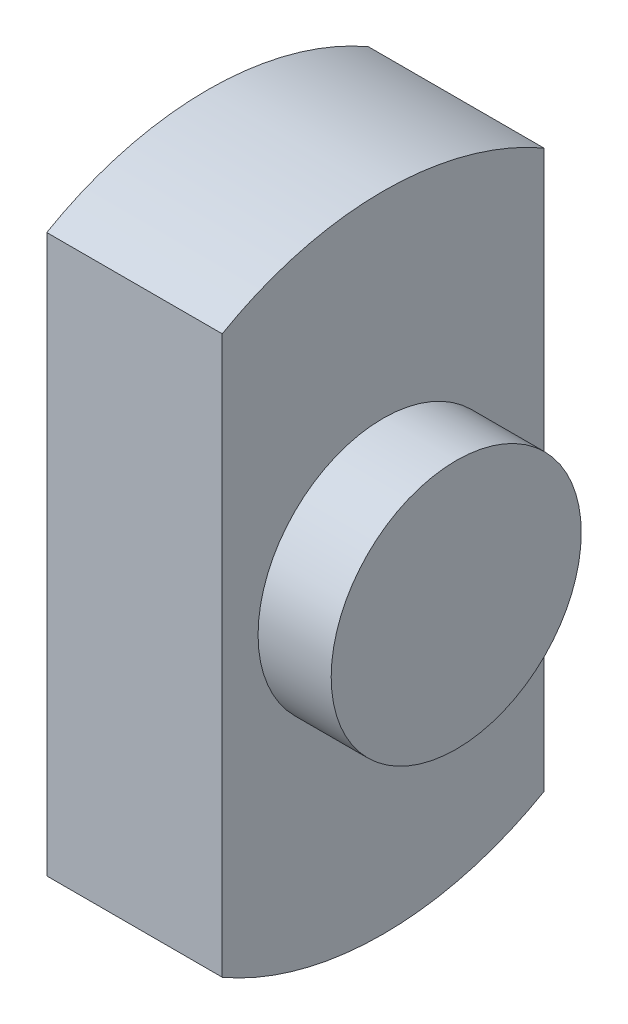
from build123d import *

# Parameters (mm, degrees)
SKETCH1_R           = 22
BOSS_EXTRUDE1_DEPTH = 12
CUT_EXTRUDE2_DEPTH  = 5.5
SKETCH15_W          = 18
SKETCH15_H          = 24.118038922
CUT_EXTRUDE3_DEPTH  = 3
SKETCH16_R          = 8.55
BOSS_EXTRUDE2_DEPTH = 5
SKETCH17_W          = 4
SKETCH17_H          = 1.75
BOSS_EXTRUDE3_DEPTH = 1
SKETCH18_W          = 4.25
SKETCH18_H          = 1.737607108
BOSS_EXTRUDE4_DEPTH = 1
CUT_EXTRUDE4_DEPTH  = 12


# Read off the part's stored shape, not the designer's step: Cut-Extrude4
with BuildPart() as part:
    # Sketch1 → Boss-Extrude1 (new body)
    with BuildSketch(Plane(origin=(0, 0, 0), x_dir=(0, 0, -1), z_dir=(1, 0, 0))):
        Circle(SKETCH1_R)
    extrude(amount=BOSS_EXTRUDE1_DEPTH)

    # Sketch13 → Cut-Extrude2 (cut)
    with BuildSketch(Plane(origin=(0, 0, 0), x_dir=(0, 0, -1), z_dir=(1, 0, 0))):
        with BuildLine():
            Line((-2.670420152, -16.85816067), (-2.670420152, -16.530371213))
            Line((-2.670420152, -16.530371213), (-4.762392892, -10))
            Line((-4.762392892, -10), (-4.762392892, -6.943148259))
            Line((-4.762392892, -6.943148259), (-6.5, -6.943148259))
            Line((-6.5, -6.943148259), (-6.5, 19.556851741))
            Line((-6.5, 19.556851741), (6.5, 19.556851741))
            Line((6.5, 19.556851741), (6.5, -6.943148259))
            Line((6.5, -6.943148259), (4.762392892, -6.943148259))
            Line((4.762392892, -6.943148259), (4.762392892, -10))
            Line((4.762392892, -10), (2.670420152, -16.530371213))
            Line((2.670420152, -16.530371213), (2.670420152, -16.85816067))
            Line((2.670420152, -16.85816067), (2.670420152, -21.837327131))
            ThreePointArc((2.670420152, -21.837327131), (1.836835043, -21.92318492), (1.000584871, -21.977234355))
            Line((1.000584871, -21.977234355), (0, -25.25))
            Line((0, -25.25), (-1.000584871, -21.977234355))
            ThreePointArc((-1.000584871, -21.977234355), (-1.836835043, -21.92318492), (-2.670420152, -21.837327131))
            Line((-2.670420152, -21.837327131), (-2.670420152, -16.85816067))
        make_face()
    extrude(amount=CUT_EXTRUDE2_DEPTH, mode=Mode.SUBTRACT)

    # Sketch15 → Cut-Extrude3 (cut)
    with BuildSketch(Plane.ZY):
        with Locations((0, 5.115871202)):
            Rectangle(SKETCH15_W, SKETCH15_H)
    extrude(amount=-CUT_EXTRUDE3_DEPTH, mode=Mode.SUBTRACT)

    # Sketch16 → Boss-Extrude2 (add)
    with BuildSketch(Plane(origin=(12, 0, 0), x_dir=(0, 0, -1), z_dir=(1, 0, 0))):
        Circle(SKETCH16_R)
    extrude(amount=BOSS_EXTRUDE2_DEPTH)

    # Sketch17 → Boss-Extrude3 (add)
    with BuildSketch(Plane(origin=(0, -6.943148259, 0), x_dir=(1, 0, 0), z_dir=(0, 1, 0))):
        with Locations((2, 5.637392892)):
            Rectangle(SKETCH17_W, SKETCH17_H)
    extrude(amount=BOSS_EXTRUDE3_DEPTH)

    # Sketch18 → Boss-Extrude4 (add)
    with BuildSketch(Plane(origin=(0, -6.943148259, 0), x_dir=(1, 0, 0), z_dir=(0, 1, 0))):
        with Locations((2.125, -5.631196446)):
            Rectangle(SKETCH18_W, SKETCH18_H)
    extrude(amount=BOSS_EXTRUDE4_DEPTH)

    # Cut-Extrude4 outline → Cut-Extrude4 (cut)
    with BuildSketch(Plane(origin=(0, 0, 0), x_dir=(0, 0, -1), z_dir=(1, 0, 0))):
        with BuildLine():
            ThreePointArc((11, -19.052558883), (22, 0), (11, 19.052558883))
            Line((11, 19.052558883), (11, -19.052558883))
        make_face()
        with BuildLine():
            Line((-11, -19.052558883), (-11, 19.052558883))
            ThreePointArc((-11, 19.052558883), (-22, 0), (-11, -19.052558883))
        make_face()
    extrude(amount=CUT_EXTRUDE4_DEPTH, mode=Mode.SUBTRACT)


solid = part.part
